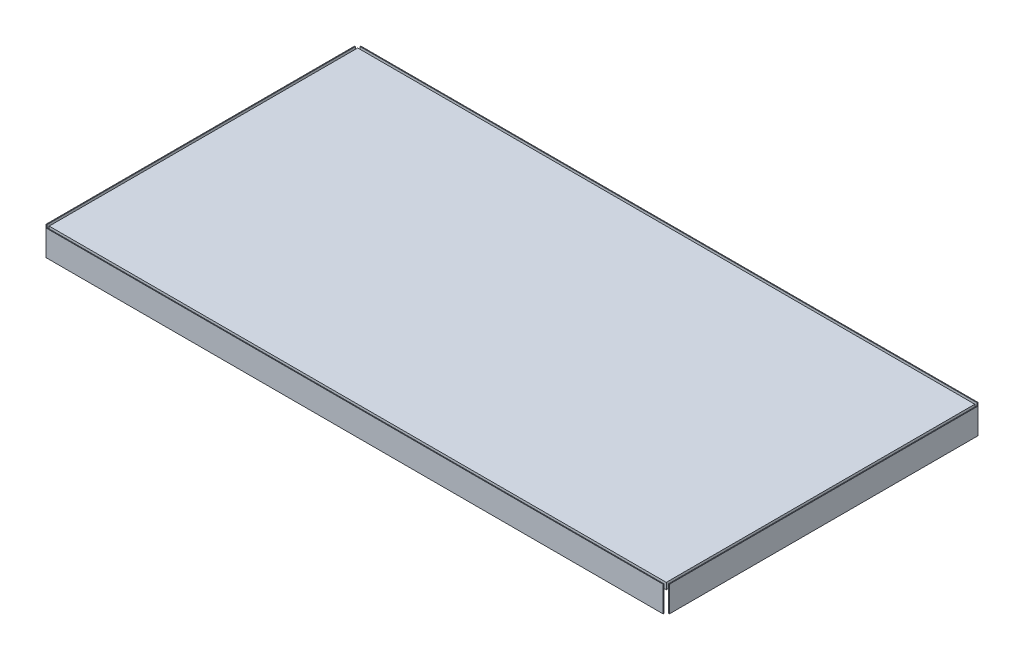
from build123d import *

# Parameters (mm, degrees)
SKETCH1_W             = 1219.2
SKETCH1_H             = 609.6
BOSS_EXTRUDE1_DEPTH   = 12.7
BOSS_EXTRUDE2_DEPTH   = 609.6
BOSS_EXTRUDE2_2_DEPTH = 609.6
BOSS_EXTRUDE3_DEPTH   = 304.8
BOSS_EXTRUDE3_2_DEPTH = 304.8
CUT_EXTRUDE1_START    = -38.1
CUT_EXTRUDE1_DEPTH    = 25.4
CUT_EXTRUDE1_2_DEPTH  = 25.4
CUT_EXTRUDE1_3_DEPTH  = 25.4
CUT_EXTRUDE1_4_DEPTH  = 25.4


# Read off the part's stored shape, not the designer's step: Cut-Extrude1
with BuildPart() as part:
    # Sketch1 → Boss-Extrude1 (new body)
    with BuildSketch(Plane(origin=(0, 0, 0), x_dir=(1, 0, 0), z_dir=(0, 1, 0))):
        Rectangle(SKETCH1_W, SKETCH1_H)
    extrude(amount=-BOSS_EXTRUDE1_DEPTH)


with BuildPart() as body_2:
    # Sketch2 → Boss-Extrude2 (new, symmetric)
    with BuildSketch(Plane(origin=(0, 0, 0), x_dir=(0, 0, -1), z_dir=(1, 0, 0))):
        Polygon((-311.15, 0), (-311.15, -50.8), (-309.626, -50.8), (-309.626, -38.1), (-284.226, -12.7), (-309.626, -12.7), (-309.626, 0), align=None)
    extrude(amount=BOSS_EXTRUDE2_DEPTH, both=True)

    # Cut-Extrude1 4 outline → Cut-Extrude1 4 (cut)
    with BuildSketch(Plane(origin=(0, 0, 0), x_dir=(1, 0, 0), z_dir=(0, 1, 0)).offset(CUT_EXTRUDE1_START)):
        Polygon((-609.6, -283), (-609.6, -309.626), (-582.974, -283), align=None)
        Polygon((609.6, -283), (582.974, -283), (609.6, -309.626), align=None)
    extrude(amount=CUT_EXTRUDE1_4_DEPTH, mode=Mode.SUBTRACT)


with BuildPart() as body_3:
    # Sketch2 → Boss-Extrude2 2 (new, symmetric)
    with BuildSketch(Plane(origin=(0, 0, 0), x_dir=(0, 0, -1), z_dir=(1, 0, 0))):
        Polygon((311.15, 0), (309.626, 0), (309.626, -12.7), (284.226, -12.7), (309.626, -38.1), (309.626, -50.8), (311.15, -50.8), align=None)
    extrude(amount=BOSS_EXTRUDE2_2_DEPTH, both=True)

    # Cut-Extrude1 2 outline → Cut-Extrude1 2 (cut)
    with BuildSketch(Plane(origin=(0, 0, 0), x_dir=(1, 0, 0), z_dir=(0, 1, 0)).offset(CUT_EXTRUDE1_START)):
        Polygon((-582.974, 283), (-609.6, 309.626), (-609.6, 283), align=None)
        Polygon((609.6, 309.626), (582.974, 283), (609.6, 283), align=None)
    extrude(amount=CUT_EXTRUDE1_2_DEPTH, mode=Mode.SUBTRACT)


with BuildPart() as body_4:
    # Sketch3 → Boss-Extrude3 (new, symmetric)
    with BuildSketch(Plane.XY):
        Polygon((615.95, 0), (614.426, 0), (614.426, -12.7), (589.026, -12.7), (614.426, -38.1), (614.426, -50.8), (615.95, -50.8), align=None)
    extrude(amount=BOSS_EXTRUDE3_DEPTH, both=True)

    # Cut-Extrude1 3 outline → Cut-Extrude1 3 (cut)
    with BuildSketch(Plane(origin=(0, 0, 0), x_dir=(1, 0, 0), z_dir=(0, 1, 0)).offset(CUT_EXTRUDE1_START)):
        Polygon((588, 278.374), (614.426, 304.8), (588, 304.8), align=None)
        Polygon((614.426, -304.8), (588, -278.374), (588, -304.8), align=None)
    extrude(amount=CUT_EXTRUDE1_3_DEPTH, mode=Mode.SUBTRACT)


with BuildPart() as body_5:
    # Sketch3 → Boss-Extrude3 2 (new, symmetric)
    with BuildSketch(Plane.XY):
        Polygon((-615.95, 0), (-614.426, 0), (-614.426, -12.7), (-589.026, -12.7), (-614.426, -38.1), (-614.426, -50.8), (-615.95, -50.8), align=None)
    extrude(amount=BOSS_EXTRUDE3_2_DEPTH, both=True)

    # Cut-Extrude1 outline → Cut-Extrude1 (cut)
    with BuildSketch(Plane(origin=(0, 0, 0), x_dir=(1, 0, 0), z_dir=(0, 1, 0)).offset(CUT_EXTRUDE1_START)):
        Polygon((-588, 304.8), (-614.426, 304.8), (-588, 278.374), align=None)
        Polygon((-588, -304.8), (-588, -278.374), (-614.426, -304.8), align=None)
    extrude(amount=CUT_EXTRUDE1_DEPTH, mode=Mode.SUBTRACT)


solid = Compound([part.part, body_2.part, body_3.part, body_4.part, body_5.part])
